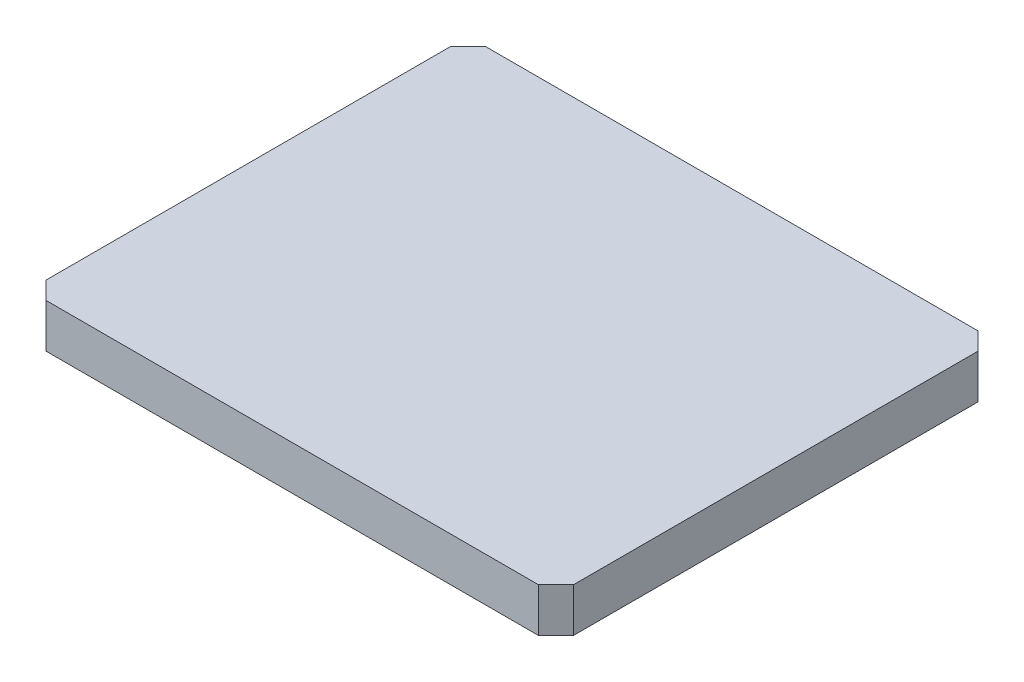
from build123d import *

# Parameters (mm, degrees)
SKETCH1_W           = 60
SKETCH1_H           = 50
BOSS_EXTRUDE1_DEPTH = 5
CHAMFER1_SIZE       = 2


with BuildPart() as part:
    # Sketch1 → Boss-Extrude1 (new body)
    with BuildSketch(Plane(origin=(0, 0, 0), x_dir=(1, 0, 0), z_dir=(0, 1, 0))):
        with Locations((30, 25)):
            Rectangle(SKETCH1_W, SKETCH1_H)
    extrude(amount=BOSS_EXTRUDE1_DEPTH)

    # Chamfer1
    chamfer1_edges = [part.edges().sort_by_distance(p)[0] for p in [
        (60, 2.5, 0),
        (60, 2.5, -50),
        (0, 2.5, 0),
        (0, 2.5, -50),
    ]]
    chamfer(chamfer1_edges, length=CHAMFER1_SIZE)


solid = part.part
